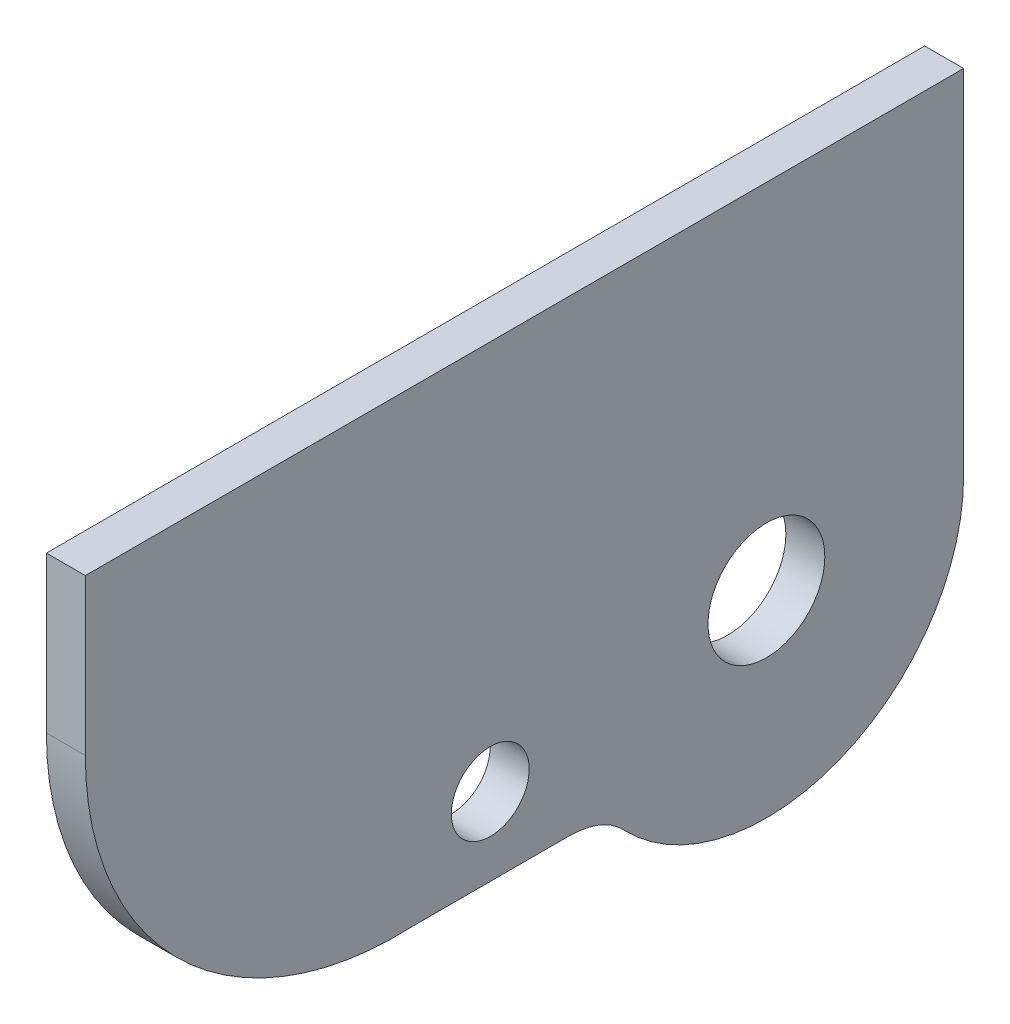
from build123d import *

# Parameters (mm, degrees)
SKETCH1_R           = 6.35
SKETCH1_R_2         = 9.525
BOSS_EXTRUDE1_DEPTH = 6.35


with BuildPart() as part:
    # Sketch1 → Boss-Extrude1 (new body)
    with BuildSketch(Plane(origin=(0, 0, 0), x_dir=(0, 0, -1), z_dir=(1, 0, 0))):
        with BuildLine():
            Line((-53.216160937, 59.584650477), (89.975645251, 59.584650477))
            Line((89.975645251, 59.584650477), (89.975645251, 1.977450477))
            ThreePointArc((89.975645251, 1.977450477), (69.827685903, -27.849983311), (34.634707874, -20.295489964))
            add(Edge.make_bspline(
                [(25.49878919, -16.615349523), (29.544814182, -16.615349523), (32.489758059, -18.062378791), (34.634707874, -20.295489964)],
                knots=[0, 0, 0, 0, 1, 1, 1, 1], degree=3))
            Line((25.49878919, -16.615349523), (0.09878919, -16.615349523))
            ThreePointArc((0.09878919, -16.615349523), (-37.4408738, -2.636280755), (-53.216160937, 34.184650477))
            Line((-53.216160937, 34.184650477), (-53.216160937, 59.584650477))
        make_face()
        with Locations((12.79878919, -3.915349523)):
            Circle(SKETCH1_R, mode=Mode.SUBTRACT)
        with Locations((57.823106874, 1.977450477)):
            Circle(SKETCH1_R_2, mode=Mode.SUBTRACT)
    extrude(amount=BOSS_EXTRUDE1_DEPTH)


solid = part.part
